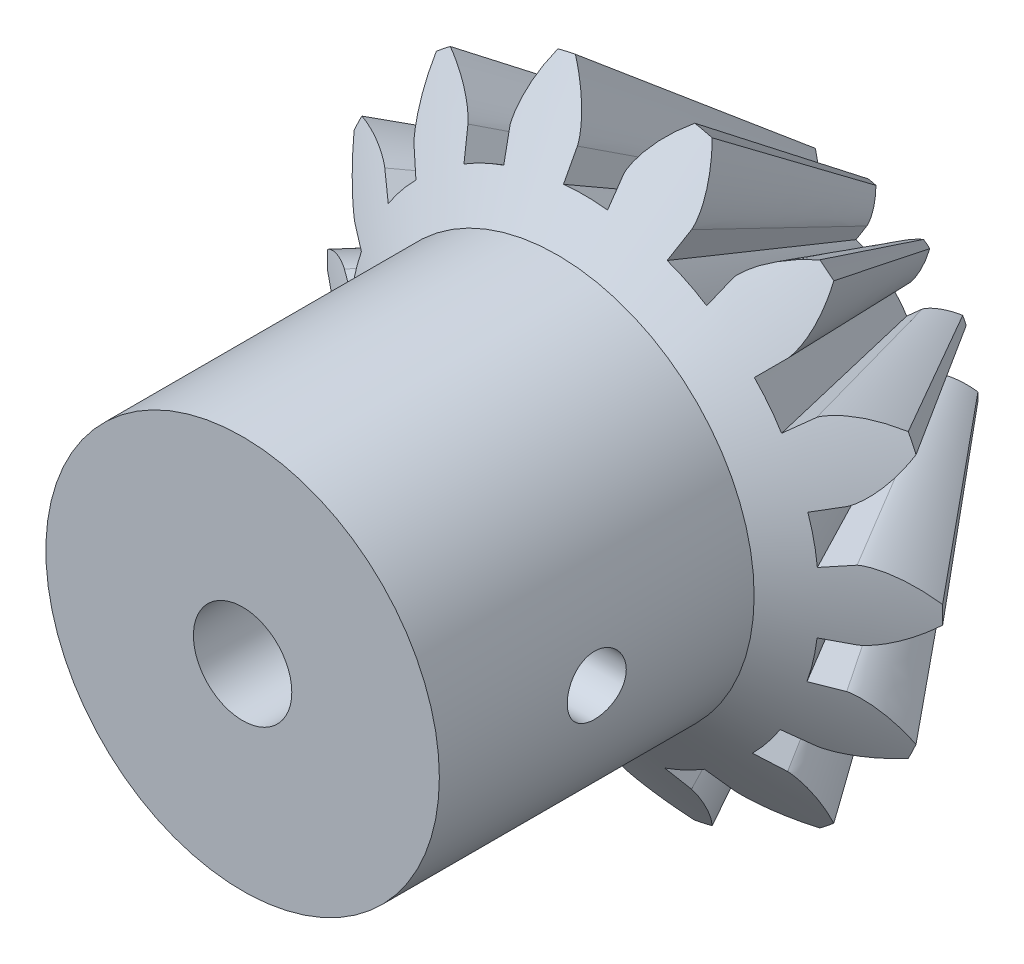
from build123d import *

# Parameters (mm, degrees)
PATTERN_CIRCULAR_1_COUNT = 14
SKETCH_6_R               = 5
SKETCH_6_R_2             = 1.25
EXTRUDE_1_DEPTH          = 8
CUT_EXTRUDE_1_DEPTH      = 16.331637568
CUT_EXTRUDE_1_DEPTH_BACK = 16.331637568
SKETCH_7_R               = 0.75
CUT_EXTRUDE_START        = -3
SKETCH_7_3_R             = 1.5
CUT_EXTRUDE_2_DEPTH      = 13.331637568


# Read off the part's stored shape, not the designer's step: 旋转1
with BuildPart() as part:
    # 旋转1 outline → 旋转1 (revolve)
    with BuildSketch(Plane.XZ):
        Polygon((0, -3.5), (0, -9.972752511), (2.382665073, -9.972752511), (3.460987812, -10.727578429), (7.819231921, -5.473462344), (5, -3.5), align=None)
    revolve(axis=Axis((0, 0, 0), (0, 0, 1)))

    # 草图3 → 切除-放样2 section 0
    with BuildSketch(Plane(origin=(0, 1.265376556, -0.885763589), x_dir=(1, 0, 0), z_dir=(0, 0.5734623443633277, 0.819231920519041)), mode=Mode.PRIVATE) as loft_2_s0:
        with BuildLine():
            Line((0.594439039, 6.457395251), (0.594439039, 5.719190697))
            ThreePointArc((0.594439039, 5.719190697), (0.033835437, 5.749900448), (-0.527090753, 5.725790368))
            Line((-0.527090753, 5.725790368), (-0.594439039, 6.457395251))
            add(Edge.make_bspline(
                [(-0.594439039, 6.457395251), (-0.595036993, 6.462619818), (-0.597071923, 6.477227569), (-0.602329586, 6.504645065), (-0.612893845, 6.54898974), (-0.629250979, 6.604832155), (-0.653679546, 6.676097393), (-0.686635678, 6.758737015), (-0.727168175, 6.848001038), (-0.775842317, 6.94325978), (-0.828387384, 7.03651543), (-0.884444322, 7.127762725), (-0.943529014, 7.216973427), (-1.018847236, 7.322916867), (-1.114326907, 7.446921263), (-1.233207398, 7.587119804), (-1.376451081, 7.740272429), (-1.531038664, 7.889666929), (-1.690103069, 8.03102394), (-1.858379352, 8.166967119), (-2.026535827, 8.293587488), (-2.208397808, 8.417607028), (-2.354703818, 8.511986859), (-2.471708684, 8.580938251), (-2.537302169, 8.618616927), (-2.556170467, 8.629368027)],
                knots=[0, 0, 0, 0, 0, 0.005376748, 0.015083688, 0.02853182, 0.046610139, 0.064854849, 0.092110525, 0.119476175, 0.146842495, 0.174208853, 0.201574955, 0.228941013, 0.256307345, 0.307035032, 0.361767351, 0.41649966, 0.471231936, 0.525964281, 0.580696615, 0.635428982, 0.690161387, 0.744893688, 0.767372065, 0.767372065, 0.767372065, 0.767372065, 0.767372065], degree=4))
            ThreePointArc((-2.556170467, 8.629368027), (0, 9), (2.556170467, 8.629368027))
            add(Edge.make_bspline(
                [(0.594439039, 6.457395251), (0.595036993, 6.462619818), (0.597071923, 6.477227569), (0.602329586, 6.504645065), (0.612893845, 6.54898974), (0.629250979, 6.604832155), (0.653679546, 6.676097393), (0.686635678, 6.758737015), (0.727168175, 6.848001038), (0.775842317, 6.94325978), (0.828387384, 7.03651543), (0.884444322, 7.127762725), (0.943529014, 7.216973427), (1.018847236, 7.322916867), (1.114326907, 7.446921263), (1.233207398, 7.587119804), (1.376451081, 7.740272429), (1.531038664, 7.889666929), (1.690103069, 8.03102394), (1.858379352, 8.166967119), (2.026535827, 8.293587488), (2.208397808, 8.417607028), (2.354703818, 8.511986859), (2.471708684, 8.580938251), (2.537302169, 8.618616927), (2.556170467, 8.629368027)],
                knots=[0, 0, 0, 0, 0, 0.005376748, 0.015083688, 0.02853182, 0.046610139, 0.064854849, 0.092110525, 0.119476175, 0.146842495, 0.174208853, 0.201574955, 0.228941013, 0.256307345, 0.307035032, 0.361767351, 0.41649966, 0.471231936, 0.525964281, 0.580696615, 0.635428982, 0.690161387, 0.744893688, 0.767372065, 0.767372065, 0.767372065, 0.767372065, 0.767372065], degree=4))
        make_face()
    loft_2 = loft([loft_2_s0.sketch, Vertex(0, 0, -14.9)], mode=Mode.SUBTRACT)

    # 阵列(圆周)1: 切除-放样2 ×14 about axis
    pattern_circular_1_axis = Axis((0, 0, -10.727578429), (0, 0, 1))
    for i in range(1, PATTERN_CIRCULAR_1_COUNT):
        add(loft_2.rotate(pattern_circular_1_axis, i * 360 / PATTERN_CIRCULAR_1_COUNT), mode=Mode.SUBTRACT)

    # 草图6 → 凸台-拉伸1 (add)
    with BuildSketch(Plane.XY.offset(-3.5)):
        with Locations(Location((0, 0, 0), (0, 0, 95.057247441))):
            Circle(SKETCH_6_R)
        Circle(SKETCH_6_R_2, mode=Mode.SUBTRACT)
    extrude(amount=EXTRUDE_1_DEPTH)

    # 草图7 → 切除-拉伸1 (cut, two sides: drawn at the far end of the back side and taken through both)
    with BuildSketch(Plane(origin=(0, 0, 0), x_dir=(0, 0, -1), z_dir=(1, 0, 0)).offset(-CUT_EXTRUDE_1_DEPTH_BACK)):
        with Locations((-0.5, 0)):
            Circle(SKETCH_7_R)
    extrude(amount=CUT_EXTRUDE_1_DEPTH + CUT_EXTRUDE_1_DEPTH_BACK, mode=Mode.SUBTRACT)

    # 草图7<3> → 切除-拉伸2 (cut, through all)
    with BuildSketch(Plane(origin=(0, 0, 0), x_dir=(0, 0, -1), z_dir=(1, 0, 0)).offset(CUT_EXTRUDE_START)):
        with Locations((-0.5, 0)):
            Circle(SKETCH_7_3_R)
    extrude(amount=-CUT_EXTRUDE_2_DEPTH, mode=Mode.SUBTRACT)


solid = part.part
